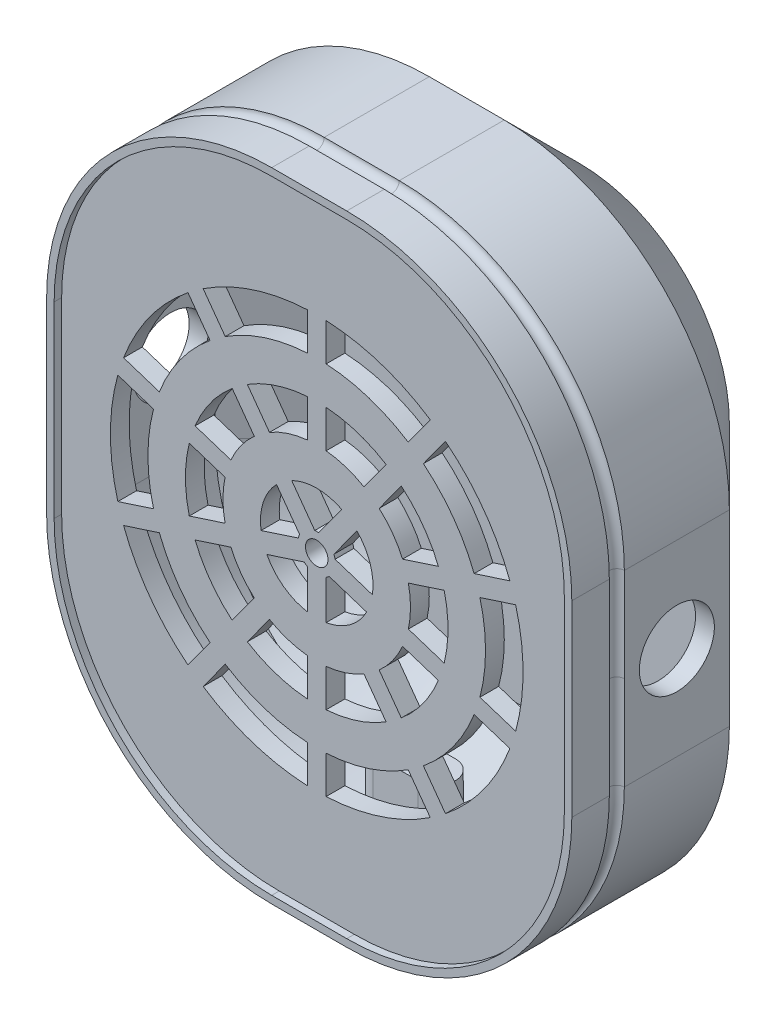
from build123d import *

# Parameters (mm, degrees)
BOSS_EXTRUDE1_DEPTH     = 20
BOSS_EXTRUDE2_DEPTH     = 10
CHAMFER1_SIZE           = 10
SKETCH6_R               = 1
SHELL1_T                = 2.5
SKETCH8_R               = 1.5
CUT_EXTRUDE3_DEPTH      = 5
CUT_EXTRUDE4_DEPTH      = 5
CUT_EXTRUDE5_DEPTH      = 85.298576658
CUT_EXTRUDE5_DEPTH_BACK = 85.298576658
SKETCH9_R               = 5
CUT_EXTRUDE6_DEPTH      = 85.298576658
CUT_EXTRUDE6_DEPTH_BACK = 5
SKETCH11_R              = 0.5
CUT_EXTRUDE7_DEPTH      = 5
BOSS_EXTRUDE4_DEPTH     = 10
BOSS_EXTRUDE5_START     = -1
BOSS_EXTRUDE5_DEPTH     = 1
BOSS_EXTRUDE6_DEPTH     = 11.5
BOSS_EXTRUDE7_DEPTH     = 11.5
BOSS_EXTRUDE8_DEPTH     = 1


with BuildPart() as part:
    # Sketch2 → Boss-Extrude1 (new body)
    with BuildSketch(Plane.XY):
        with BuildLine():
            Line((5, -42.5), (-5, -42.5))
            ThreePointArc((-5, -42.5), (-26.213203436, -33.713203436), (-35, -12.5))
            Line((-35, -12.5), (-35, 12.5))
            ThreePointArc((-35, 12.5), (-26.213203436, 33.713203436), (-5, 42.5))
            Line((-5, 42.5), (5, 42.5))
            ThreePointArc((5, 42.5), (26.213203436, 33.713203436), (35, 12.5))
            Line((35, 12.5), (35, -12.5))
            ThreePointArc((35, -12.5), (26.213203436, -33.713203436), (5, -42.5))
        make_face()
    extrude(amount=BOSS_EXTRUDE1_DEPTH)

    # Sketch3 → Boss-Extrude2 (add)
    with BuildSketch(Plane(origin=(0, 0, 0), x_dir=(-1, 0, 0), z_dir=(0, 0, -1))):
        with BuildLine():
            Line((25, -12.5), (25, 12.5))
            ThreePointArc((25, 12.5), (19.142135624, 26.642135624), (5, 32.5))
            Line((5, 32.5), (-5, 32.5))
            ThreePointArc((-5, 32.5), (-19.142135624, 26.642135624), (-25, 12.5))
            Line((-25, 12.5), (-25, -12.5))
            ThreePointArc((-25, -12.5), (-19.142135624, -26.642135624), (-5, -32.5))
            Line((-5, -32.5), (5, -32.5))
            ThreePointArc((5, -32.5), (19.142135624, -26.642135624), (25, -12.5))
        make_face()
    extrude(amount=BOSS_EXTRUDE2_DEPTH)

    # Chamfer1
    chamfer1_edges = [part.edges().sort_by_distance(p)[0] for p in [
        (0, -32.5, 0),
        (-19.142135624, -26.642135624, 0),
        (19.142135624, -26.642135624, 0),
        (-25, 0, 0),
        (25, 0, 0),
        (-19.142135624, 26.642135624, 0),
        (19.142135624, 26.642135624, 0),
        (0, 32.5, 0),
    ]]
    chamfer(chamfer1_edges, length=CHAMFER1_SIZE - 0.0001)  # a hair under: the kernel refuses the full size

    # Cut-Sweep1: sweep along a path in Sketch5
    with BuildLine(Plane.XY.offset(15)) as cut_sweep1_path:
        Line((-5, -42.5), (5, -42.5))
        ThreePointArc((5, -42.5), (26.213203436, -33.713203436), (35, -12.5))
        Line((35, -12.5), (35, 12.5))
        ThreePointArc((35, 12.5), (26.213203436, 33.713203436), (5, 42.5))
        Line((5, 42.5), (-5, 42.5))
        ThreePointArc((-5, 42.5), (-26.213203436, 33.713203436), (-35, 12.5))
        Line((-35, 12.5), (-35, -12.5))
        ThreePointArc((-35, -12.5), (-26.213203436, -33.713203436), (-5, -42.5))
    # Sketch6 → Cut-Sweep1 (sweep, cut)
    with BuildSketch(Plane(origin=(0, 0, 0), x_dir=(1, 0, 0), z_dir=(0, 1, 0))):
        with Locations((35, -15)):
            Circle(SKETCH6_R)
    sweep(path=cut_sweep1_path.line, mode=Mode.SUBTRACT)

    # Shell1 (no face opened: a closed hollow body)
    add(offset(amount=-SHELL1_T, mode=Mode.PRIVATE), mode=Mode.SUBTRACT)

    # Sketch8 → Cut-Extrude3 (cut)
    with BuildSketch(Plane.XY.offset(20)):
        with BuildLine():
            Line((-21.751994544, 5.753323679), (-26.51329282, 7.300363269))
            ThreePointArc((-26.51329282, 7.300363269), (-27.5, 0), (-26.51329282, -7.300363269))
            Line((-26.51329282, -7.300363269), (-21.751994544, -5.753323679))
            ThreePointArc((-21.751994544, -5.753323679), (-22.5, 0), (-21.751994544, 5.753323679))
        make_face()
        with BuildLine():
            Line((-12.214887314, 2.654529695), (-16.987248104, 4.205163713))
            ThreePointArc((-16.987248104, 4.205163713), (-17.5, 0), (-16.987248104, -4.205163713))
            Line((-16.987248104, -4.205163713), (-12.214887314, -2.654529695))
            ThreePointArc((-12.214887314, -2.654529695), (-12.5, 0), (-12.214887314, 2.654529695))
        make_face()
        with BuildLine():
            Line((-14.216014437, 17.440038232), (-17.158658602, 21.490240459))
            ThreePointArc((-17.158658602, 21.490240459), (-22.247967345, 16.164094438), (-25.740750334, 9.67800456))
            Line((-25.740750334, 9.67800456), (-20.979452058, 8.13096497))
            ThreePointArc((-20.979452058, 8.13096497), (-18.202882373, 13.225168177), (-14.216014437, 17.440038232))
        make_face()
        with BuildLine():
            Line((-8.321758015, 9.327290257), (-11.271239189, 13.386902821))
            ThreePointArc((-11.271239189, 13.386902821), (-14.157797402, 10.286241915), (-16.214705618, 6.582805004))
            Line((-16.214705618, 6.582805004), (-11.442344828, 5.032170986))
            ThreePointArc((-11.442344828, 5.032170986), (-10.11271243, 7.347315654), (-8.321758015, 9.327290257))
        make_face()
        with BuildLine():
            Line((-1.25, 22.465250945), (-1.25, 27.47157622))
            ThreePointArc((-1.25, 27.47157622), (-8.497967345, 26.154054198), (-15.136116116, 22.959703589))
            Line((-15.136116116, 22.959703589), (-12.193471951, 18.909501362))
            ThreePointArc((-12.193471951, 18.909501362), (-6.952882373, 21.398771617), (-1.25, 22.465250945))
        make_face()
        with BuildLine():
            Line((-1.25, 12.437342964), (-1.25, 17.455300055))
            ThreePointArc((-1.25, 17.455300055), (-5.407797402, 16.643489035), (-9.248696704, 14.856365952))
            Line((-9.248696704, 14.856365952), (-6.299215529, 10.796753388))
            ThreePointArc((-6.299215529, 10.796753388), (-3.86271243, 11.888206454), (-1.25, 12.437342964))
        make_face()
        with BuildLine():
            Line((12.193471951, 18.909501362), (15.136116116, 22.959703589))
            ThreePointArc((15.136116116, 22.959703589), (8.497967345, 26.154054198), (1.25, 27.47157622))
            Line((1.25, 27.47157622), (1.25, 22.465250945))
            ThreePointArc((1.25, 22.465250945), (6.952882373, 21.398771617), (12.193471951, 18.909501362))
        make_face()
        with BuildLine():
            Line((6.299215529, 10.796753388), (9.248696704, 14.856365952))
            ThreePointArc((9.248696704, 14.856365952), (5.407797402, 16.643489035), (1.25, 17.455300055))
            Line((1.25, 17.455300055), (1.25, 12.437342964))
            ThreePointArc((1.25, 12.437342964), (3.86271243, 11.888206454), (6.299215529, 10.796753388))
        make_face()
        with BuildLine():
            ThreePointArc((25.740750334, 9.67800456), (22.247967345, 16.164094438), (17.158658602, 21.490240459))
            Line((17.158658602, 21.490240459), (14.216014437, 17.440038232))
            ThreePointArc((14.216014437, 17.440038232), (18.202882373, 13.225168177), (20.979452058, 8.13096497))
            Line((20.979452058, 8.13096497), (25.740750334, 9.67800456))
        make_face()
        with BuildLine():
            ThreePointArc((16.214705618, 6.582805004), (14.157797402, 10.286241915), (11.271239189, 13.386902821))
            Line((11.271239189, 13.386902821), (8.321758015, 9.327290257))
            ThreePointArc((8.321758015, 9.327290257), (10.11271243, 7.347315654), (11.442344828, 5.032170986))
            Line((11.442344828, 5.032170986), (16.214705618, 6.582805004))
        make_face()
        with BuildLine():
            ThreePointArc((16.987248104, -4.205163713), (17.5, 0), (16.987248104, 4.205163713))
            Line((16.987248104, 4.205163713), (12.214887314, 2.654529695))
            ThreePointArc((12.214887314, 2.654529695), (12.5, 0), (12.214887314, -2.654529695))
            Line((12.214887314, -2.654529695), (16.987248104, -4.205163713))
        make_face()
        with BuildLine():
            ThreePointArc((27.5, 0), (27.252206815, 3.683371245), (26.51329282, 7.300363269))
            Line((26.51329282, 7.300363269), (21.751994544, 5.753323679))
            ThreePointArc((21.751994544, 5.753323679), (22.5, 0), (21.751994544, -5.753323679))
            Line((21.751994544, -5.753323679), (26.51329282, -7.300363269))
            ThreePointArc((26.51329282, -7.300363269), (27.252206815, -3.683371245), (27.5, 0))
        make_face()
        with BuildLine():
            ThreePointArc((17.158658602, -21.490240459), (22.247967345, -16.164094438), (25.740750334, -9.67800456))
            Line((25.740750334, -9.67800456), (20.979452058, -8.13096497))
            ThreePointArc((20.979452058, -8.13096497), (18.202882373, -13.225168177), (14.216014437, -17.440038232))
            Line((14.216014437, -17.440038232), (17.158658602, -21.490240459))
        make_face()
        with BuildLine():
            ThreePointArc((11.271239189, -13.386902821), (14.157797402, -10.286241915), (16.214705618, -6.582805004))
            Line((16.214705618, -6.582805004), (11.442344828, -5.032170986))
            ThreePointArc((11.442344828, -5.032170986), (10.11271243, -7.347315654), (8.321758015, -9.327290257))
            Line((8.321758015, -9.327290257), (11.271239189, -13.386902821))
        make_face()
        with BuildLine():
            ThreePointArc((1.25, -17.455300055), (5.407797402, -16.643489035), (9.248696704, -14.856365952))
            Line((9.248696704, -14.856365952), (6.299215529, -10.796753388))
            ThreePointArc((6.299215529, -10.796753388), (3.86271243, -11.888206454), (1.25, -12.437342964))
            Line((1.25, -12.437342964), (1.25, -17.455300055))
        make_face()
        with BuildLine():
            Line((-1.25, -17.455300055), (-1.25, -12.437342964))
            ThreePointArc((-1.25, -12.437342964), (-3.86271243, -11.888206454), (-6.299215529, -10.796753388))
            Line((-6.299215529, -10.796753388), (-9.248696704, -14.856365952))
            ThreePointArc((-9.248696704, -14.856365952), (-5.407797402, -16.643489035), (-1.25, -17.455300055))
        make_face()
        with BuildLine():
            ThreePointArc((-15.136116116, -22.959703589), (-8.497967345, -26.154054198), (-1.25, -27.47157622))
            Line((-1.25, -27.47157622), (-1.25, -22.465250945))
            ThreePointArc((-1.25, -22.465250945), (-6.952882373, -21.398771617), (-12.193471951, -18.909501362))
            Line((-12.193471951, -18.909501362), (-15.136116116, -22.959703589))
        make_face()
        with BuildLine():
            ThreePointArc((1.25, -27.47157622), (8.497967345, -26.154054198), (15.136116116, -22.959703589))
            Line((15.136116116, -22.959703589), (12.193471951, -18.909501362))
            ThreePointArc((12.193471951, -18.909501362), (6.952882373, -21.398771617), (1.25, -22.465250945))
            Line((1.25, -22.465250945), (1.25, -27.47157622))
        make_face()
        with BuildLine():
            Line((-20.979452058, -8.13096497), (-25.740750334, -9.67800456))
            ThreePointArc((-25.740750334, -9.67800456), (-22.247967345, -16.164094438), (-17.158658602, -21.490240459))
            Line((-17.158658602, -21.490240459), (-14.216014437, -17.440038232))
            ThreePointArc((-14.216014437, -17.440038232), (-18.202882373, -13.225168177), (-20.979452058, -8.13096497))
        make_face()
        with BuildLine():
            Line((-11.442344828, -5.032170986), (-16.214705618, -6.582805004))
            ThreePointArc((-16.214705618, -6.582805004), (-14.157797402, -10.286241915), (-11.271239189, -13.386902821))
            Line((-11.271239189, -13.386902821), (-8.321758015, -9.327290257))
            ThreePointArc((-8.321758015, -9.327290257), (-10.11271243, -7.347315654), (-11.442344828, -5.032170986))
        make_face()
        Circle(SKETCH8_R)
    extrude(amount=-CUT_EXTRUDE3_DEPTH, mode=Mode.SUBTRACT)

    # Sketch8<5> → Cut-Extrude4 (cut)
    with BuildSketch(Plane.XY.offset(20)):
        with BuildLine():
            ThreePointArc((-2.445369002, 0.519779227), (-2.377641291, 0.772542486), (-2.283863644, 1.016841608))
            Line((-2.283863644, 1.016841608), (-5.358001803, 5.24802979))
            ThreePointArc((-5.358001803, 5.24802979), (-6.067627458, 4.408389392), (-6.646886543, 3.474032137))
            ThreePointArc((-6.646886543, 3.474032137), (-7.132923872, 2.317627458), (-7.419429029, 1.096390846))
            ThreePointArc((-7.419429029, 1.096390846), (-7.5, 0), (-7.419429029, -1.096390846))
            Line((-7.419429029, -1.096390846), (-2.445369002, 0.519779227))
        make_face()
        with BuildLine():
            Line((0.261321158, 2.486304738), (3.335459317, 6.717492921))
            ThreePointArc((3.335459317, 6.717492921), (2.317627458, 7.132923872), (1.25, 7.395099729))
            ThreePointArc((1.25, 7.395099729), (0, 7.5), (-1.25, 7.395099729))
            ThreePointArc((-1.25, 7.395099729), (-2.317627458, 7.132923872), (-3.335459317, 6.717492921))
            Line((-3.335459317, 6.717492921), (-0.261321158, 2.486304738))
            ThreePointArc((-0.261321158, 2.486304738), (0, 2.5), (0.261321158, 2.486304738))
        make_face()
        with BuildLine():
            ThreePointArc((6.646886543, 3.474032137), (6.067627458, 4.408389392), (5.358001803, 5.24802979))
            Line((5.358001803, 5.24802979), (2.283863644, 1.016841608))
            ThreePointArc((2.283863644, 1.016841608), (2.377641291, 0.772542486), (2.445369002, 0.519779227))
            Line((2.445369002, 0.519779227), (7.419429029, -1.096390846))
            ThreePointArc((7.419429029, -1.096390846), (7.479830136, -0.549673669), (7.5, 0))
            ThreePointArc((7.5, 0), (7.479830136, 0.549673669), (7.419429029, 1.096390846))
            ThreePointArc((7.419429029, 1.096390846), (7.132923872, 2.317627458), (6.646886543, 3.474032137))
        make_face()
        with BuildLine():
            ThreePointArc((5.358001803, -5.24802979), (6.067627458, -4.408389392), (6.646886543, -3.474032137))
            Line((6.646886543, -3.474032137), (1.672826516, -1.857862064))
            ThreePointArc((1.672826516, -1.857862064), (1.469463131, -2.022542486), (1.25, -2.165063509))
            Line((1.25, -2.165063509), (1.25, -7.395099729))
            ThreePointArc((1.25, -7.395099729), (2.317627458, -7.132923872), (3.335459317, -6.717492921))
            ThreePointArc((3.335459317, -6.717492921), (4.408389392, -6.067627458), (5.358001803, -5.24802979))
        make_face()
        with BuildLine():
            ThreePointArc((-1.25, -2.165063509), (-1.469463131, -2.022542486), (-1.672826516, -1.857862064))
            Line((-1.672826516, -1.857862064), (-6.646886543, -3.474032137))
            ThreePointArc((-6.646886543, -3.474032137), (-6.067627458, -4.408389392), (-5.358001803, -5.24802979))
            ThreePointArc((-5.358001803, -5.24802979), (-4.408389392, -6.067627458), (-3.335459317, -6.717492921))
            ThreePointArc((-3.335459317, -6.717492921), (-2.317627458, -7.132923872), (-1.25, -7.395099729))
            Line((-1.25, -7.395099729), (-1.25, -2.165063509))
        make_face()
    extrude(amount=-CUT_EXTRUDE4_DEPTH, mode=Mode.SUBTRACT)

    # Sketch9 → Cut-Extrude5 (cut, two sides: drawn at the far end of the back side and taken through both)
    with BuildSketch(Plane.ZY.offset(35).offset(-CUT_EXTRUDE5_DEPTH_BACK)):
        with Locations((7, 0)):
            Circle(SKETCH9_R)
    extrude(amount=CUT_EXTRUDE5_DEPTH + CUT_EXTRUDE5_DEPTH_BACK, mode=Mode.SUBTRACT)

    # Sketch10 → Cut-Extrude6 (cut, two sides: drawn at the far end of the back side and taken through both)
    with BuildSketch(Plane.ZY.offset(35).offset(-CUT_EXTRUDE6_DEPTH_BACK)):
        with BuildLine():
            Line((6, 12.5), (6, 15.696080429))
            ThreePointArc((6, 15.696080429), (7, 16.696080429), (8, 15.696080429))
            Line((8, 15.696080429), (8, 12.5))
            ThreePointArc((8, 12.5), (7, 11.5), (6, 12.5))
        make_face()
    extrude(amount=CUT_EXTRUDE6_DEPTH + CUT_EXTRUDE6_DEPTH_BACK, mode=Mode.SUBTRACT)

    # Sketch11 → Cut-Extrude7 (cut)
    with BuildSketch(Plane.XZ.offset(42.5)):
        with Locations(Location((8.280092086, 7, 0), (0, 0, 270))):
            Circle(SKETCH11_R)
        with BuildLine():
            Line((3, 5.5), (-3, 5.5))
            ThreePointArc((-3, 5.5), (-4.5, 7), (-3, 8.5))
            Line((-3, 8.5), (3, 8.5))
            ThreePointArc((3, 8.5), (4.5, 7), (3, 5.5))
        make_face()
    extrude(amount=-CUT_EXTRUDE7_DEPTH, mode=Mode.SUBTRACT)

    # Sketch12 → Boss-Extrude4 (add)
    with BuildSketch(Plane(origin=(0, -40, 0), x_dir=(1, 0, 0), z_dir=(0, 1, 0))):
        with BuildLine():
            Line((3, -4.5), (-3, -4.5))
            ThreePointArc((-3, -4.5), (-5.5, -7), (-3, -9.5))
            Line((-3, -9.5), (3, -9.5))
            ThreePointArc((3, -9.5), (5.5, -7), (3, -4.5))
        make_face()
        with BuildLine():
            Line((3, -5.5), (-3, -5.5))
            ThreePointArc((-3, -5.5), (-4.5, -7), (-3, -8.5))
            Line((-3, -8.5), (3, -8.5))
            ThreePointArc((3, -8.5), (4.5, -7), (3, -5.5))
        make_face(mode=Mode.SUBTRACT)
    extrude(amount=BOSS_EXTRUDE4_DEPTH)

    # Sketch13 → Boss-Extrude5 (add)
    with BuildSketch(Plane(origin=(0, -30, 0), x_dir=(1, 0, 0), z_dir=(0, 1, 0)).offset(BOSS_EXTRUDE5_START)):
        with BuildLine():
            Line((3, -4.5), (-3, -4.5))
            ThreePointArc((-3, -4.5), (-5.5, -7), (-3, -9.5))
            Line((-3, -9.5), (3, -9.5))
            ThreePointArc((3, -9.5), (5.5, -7), (3, -4.5))
        make_face()
    extrude(amount=BOSS_EXTRUDE5_DEPTH)

    # Sketch14 → Boss-Extrude6 (add)
    with BuildSketch(Plane.XZ.offset(31)):
        with BuildLine():
            Line((-3, 6.5), (3, 6.5))
            ThreePointArc((3, 6.5), (3.5, 7), (3, 7.5))
            Line((3, 7.5), (-3, 7.5))
            ThreePointArc((-3, 7.5), (-3.5, 7), (-3, 6.5))
        make_face()
    extrude(amount=BOSS_EXTRUDE6_DEPTH)

    # Sketch15 → Boss-Extrude7 (add)
    with BuildSketch(Plane.XZ.offset(31)):
        with BuildLine():
            Line((-3, 5.6), (3, 5.6))
            ThreePointArc((3, 5.6), (4.4, 7), (3, 8.4))
            Line((3, 8.4), (-3, 8.4))
            ThreePointArc((-3, 8.4), (-4.4, 7), (-3, 5.6))
        make_face()
        with BuildLine():
            Line((-3, 5.7), (3, 5.7))
            ThreePointArc((3, 5.7), (4.3, 7), (3, 8.3))
            Line((3, 8.3), (-3, 8.3))
            ThreePointArc((-3, 8.3), (-4.3, 7), (-3, 5.7))
        make_face(mode=Mode.SUBTRACT)
    extrude(amount=BOSS_EXTRUDE7_DEPTH)

    # Sketch16 → Boss-Extrude8 (add)
    with BuildSketch(Plane.XY.offset(20)):
        with BuildLine():
            Line((-5, -42.5), (5, -42.5))
            ThreePointArc((5, -42.5), (26.213203436, -33.713203436), (35, -12.5))
            Line((35, -12.5), (35, 12.5))
            ThreePointArc((35, 12.5), (26.213203436, 33.713203436), (5, 42.5))
            Line((5, 42.5), (-5, 42.5))
            ThreePointArc((-5, 42.5), (-26.213203436, 33.713203436), (-35, 12.5))
            Line((-35, 12.5), (-35, -12.5))
            ThreePointArc((-35, -12.5), (-26.213203436, -33.713203436), (-5, -42.5))
        make_face()
        with BuildLine():
            Line((-5, -41.5), (5, -41.5))
            ThreePointArc((5, -41.5), (25.506096654, -33.006096654), (34, -12.5))
            Line((34, -12.5), (34, 12.5))
            ThreePointArc((34, 12.5), (25.506096654, 33.006096654), (5, 41.5))
            Line((5, 41.5), (-5, 41.5))
            ThreePointArc((-5, 41.5), (-25.506096654, 33.006096654), (-34, 12.5))
            Line((-34, 12.5), (-34, -12.5))
            ThreePointArc((-34, -12.5), (-25.506096654, -33.006096654), (-5, -41.5))
        make_face(mode=Mode.SUBTRACT)
    extrude(amount=BOSS_EXTRUDE8_DEPTH)


solid = part.part
